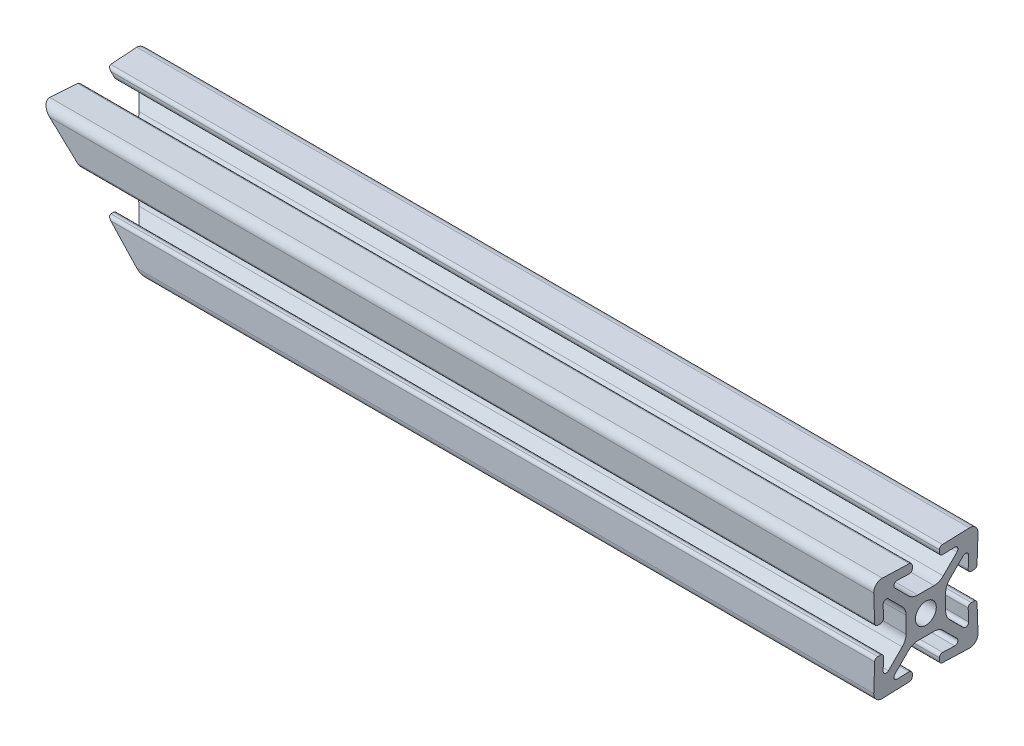
from build123d import *
from OCP.BRepAlgoAPI import BRepAlgoAPI_Cut
from OCP.TopTools import TopTools_ListOfShape

# Parameters (mm, degrees)
BOSS_EXTRUDE1_DEPTH      = 101.413073
BOSS_EXTRUDE1_DEPTH_BACK = 101.413073
CUT_EXTRUDE7_DEPTH       = 115.133874793


with BuildPart() as part:
    # Sketch3 → Boss-Extrude1 (new, two sides: drawn at the far end of the back side and taken through both)
    with BuildSketch(Plane(origin=(0, 0, 0), x_dir=(0, 0, -1), z_dir=(1, 0, 0)).offset(-BOSS_EXTRUDE1_DEPTH_BACK)):
        with BuildLine():
            Line((0, 4.826), (1.984228399, 4.826))
            ThreePointArc((1.984228399, 4.826), (3.199248297, 5.067682484), (4.229292429, 5.75593597))
            Line((4.229292429, 5.75593597), (7.586577723, 9.113221264))
            ThreePointArc((7.586577723, 9.113221264), (7.746562132, 9.955883421), (7.021168939, 10.413572441))
            Line((7.021168939, 10.413572441), (4.090593416, 10.311234489))
            ThreePointArc((4.090593416, 10.311234489), (3.534670322, 10.524633371), (3.302, 11.072770299))
            Line((3.302, 11.072770299), (3.302, 11.70815736))
            ThreePointArc((3.302, 11.70815736), (3.515863072, 12.237487038), (4.037406584, 12.46969317))
            Line((4.037406584, 12.46969317), (10.597084223, 12.698762161))
            ThreePointArc((10.597084223, 12.698762161), (12.104840979, 12.104840979), (12.698762161, 10.597084223))
            Line((12.698762161, 10.597084223), (12.46969317, 4.037406584))
            ThreePointArc((12.46969317, 4.037406584), (12.237487038, 3.515863072), (11.70815736, 3.302))
            Line((11.70815736, 3.302), (11.072770299, 3.302))
            ThreePointArc((11.072770299, 3.302), (10.524633371, 3.534670322), (10.311234489, 4.090593416))
            Line((10.311234489, 4.090593416), (10.413572441, 7.021168939))
            ThreePointArc((10.413572441, 7.021168939), (9.955883421, 7.746562132), (9.113221264, 7.586577723))
            Line((9.113221264, 7.586577723), (5.75593597, 4.229292429))
            ThreePointArc((5.75593597, 4.229292429), (5.067682484, 3.199248297), (4.826, 1.984228399))
            Line((4.826, 1.984228399), (4.826, 0))
            Line((4.826, 0), (2.54, 0))
            ThreePointArc((2.54, 0), (1.796051224, 1.796051224), (0, 2.54))
            Line((0, 2.54), (0, 4.826))
        make_face()
    extrude(amount=BOSS_EXTRUDE1_DEPTH + BOSS_EXTRUDE1_DEPTH_BACK)

    # Mirror1: part across plane


with BuildPart() as part_1:
    add(part.part)
    add(part.part.mirror(Plane.ZX))

    # Mirror2: part across plane


with BuildPart() as part_2:
    add(part_1.part)
    add(part_1.part.mirror(Plane.XY))


with BuildPart() as cut_extrude7_tool:
    # Sketch10 → Cut-Extrude7 (new, through all)
    with BuildSketch(Plane.XY.offset(38.1)):
        Polygon((-76.013073399, -12.7), (-101.413073399, 12.7), (-101.413073399, -12.7), align=None)
        Polygon((-76.013073399, -12.7), (-101.413073399, -12.7), (-101.413073399, 12.7), (-106.454619086, 17.741545687), (-105.960543128, -16.167906454), (-72.545166945, -16.167906454), align=None)
    extrude(amount=-CUT_EXTRUDE7_DEPTH)


with BuildPart() as part_3:
    add(part_2.part)

    # Cut-Extrude7: cut by cut_extrude7_tool, with a tolerance
    cut_extrude7_stock = TopTools_ListOfShape()
    cut_extrude7_stock.Append(part_3.part.wrapped)
    cut_extrude7_tools = TopTools_ListOfShape()
    cut_extrude7_tools.Append(cut_extrude7_tool.part.wrapped)
    cut_extrude7_cut = BRepAlgoAPI_Cut()
    cut_extrude7_cut.SetArguments(cut_extrude7_stock)
    cut_extrude7_cut.SetTools(cut_extrude7_tools)
    cut_extrude7_cut.SetFuzzyValue(0.00001)
    cut_extrude7_cut.Build()
    add(Compound.cast(cut_extrude7_cut.Shape()).solids(), mode=Mode.REPLACE)


solid = part_3.part
